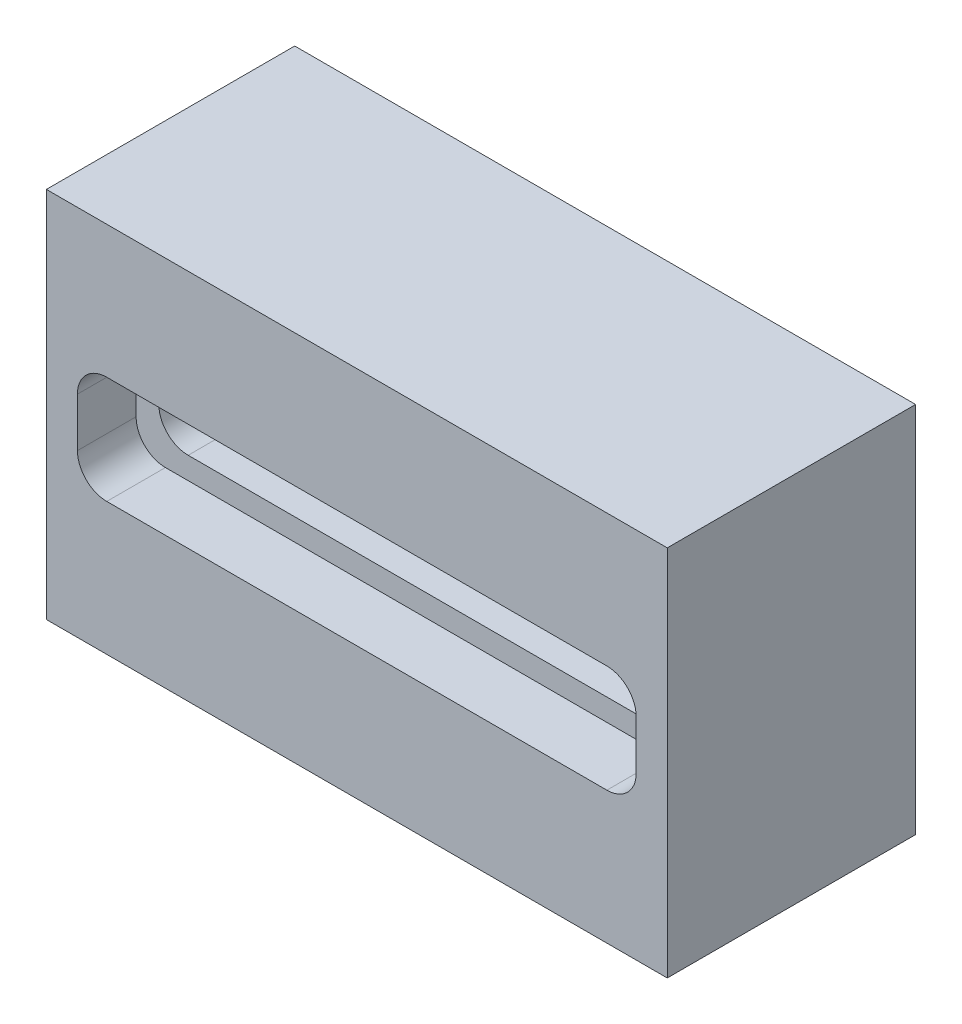
from build123d import *

# Parameters (mm, degrees)
SKETCH1_W           = 127
SKETCH1_H           = 50.8
BOSS_EXTRUDE1_DEPTH = 76.2
CUT_EXTRUDE2_DEPTH  = 12
CUT_EXTRUDE3_DEPTH  = 157.576115675


with BuildPart() as part:
    # Sketch1 → Boss-Extrude1 (new body)
    with BuildSketch(Plane(origin=(0, 0, 0), x_dir=(1, 0, 0), z_dir=(0, 1, 0))):
        with Locations((63.5, 25.4)):
            Rectangle(SKETCH1_W, SKETCH1_H)
    extrude(amount=BOSS_EXTRUDE1_DEPTH)

    # Sketch3 → Cut-Extrude2 (cut)
    with BuildSketch(Plane.XY):
        with BuildLine():
            Line((12.35, 49.1), (114.65, 49.1))
            ThreePointArc((114.65, 49.1), (118.892640687, 47.342640687), (120.65, 43.1))
            Line((120.65, 43.1), (120.65, 33.1))
            ThreePointArc((120.65, 33.1), (118.892640687, 28.857359313), (114.65, 27.1))
            Line((114.65, 27.1), (12.35, 27.1))
            ThreePointArc((12.35, 27.1), (8.107359313, 28.857359313), (6.35, 33.1))
            Line((6.35, 33.1), (6.35, 43.1))
            ThreePointArc((6.35, 43.1), (8.107359313, 47.342640687), (12.35, 49.1))
        make_face()
    extrude(amount=-CUT_EXTRUDE2_DEPTH, mode=Mode.SUBTRACT)

    # Sketch2 → Cut-Extrude3 (cut, through all)
    with BuildSketch(Plane.XY):
        with BuildLine():
            Line((17, 44.6), (110, 44.6))
            ThreePointArc((110, 44.6), (114.242640687, 42.842640687), (116, 38.6))
            Line((116, 38.6), (116, 37.6))
            ThreePointArc((116, 37.6), (114.242640687, 33.357359313), (110, 31.6))
            Line((110, 31.6), (17, 31.6))
            ThreePointArc((17, 31.6), (12.757359313, 33.357359313), (11, 37.6))
            Line((11, 37.6), (11, 38.6))
            ThreePointArc((11, 38.6), (12.757359313, 42.842640687), (17, 44.6))
        make_face()
    extrude(amount=-CUT_EXTRUDE3_DEPTH, mode=Mode.SUBTRACT)


solid = part.part
